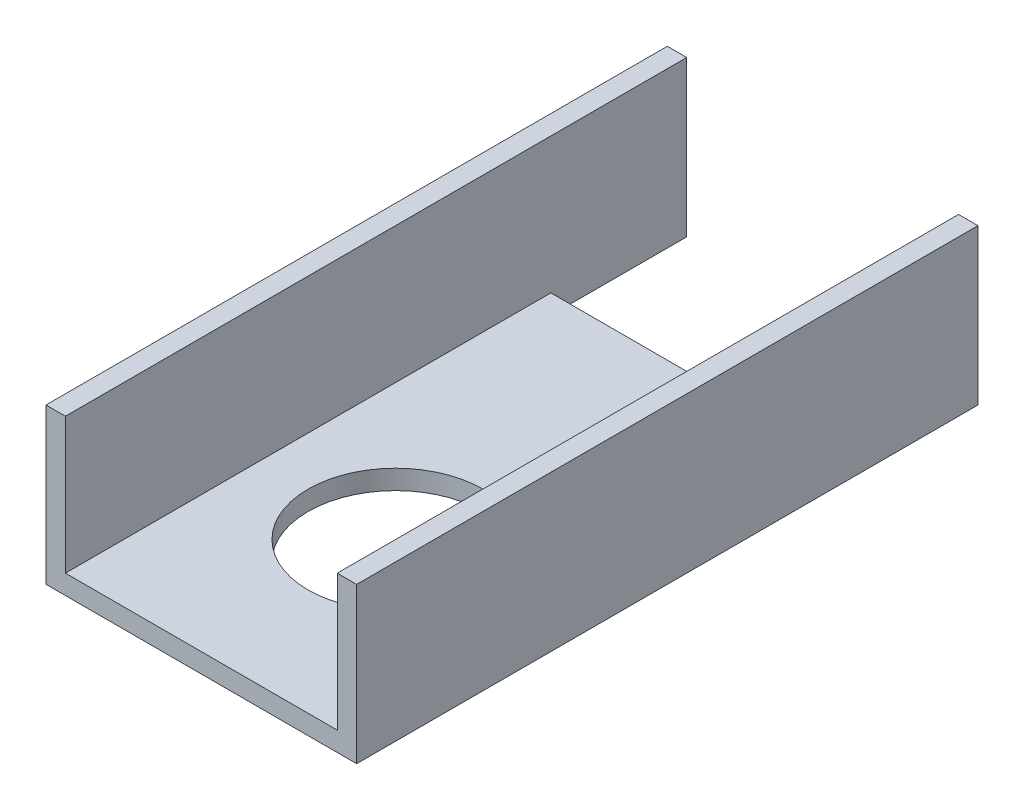
from build123d import *

# Parameters (mm, degrees)
BOSS_EXTRUDE1_DEPTH = 101.6
CUT_EXTRUDE1_REACH  = 118.397
SKETCH2_R           = 14.2875
CUT_EXTRUDE2_REACH  = 117.746
SKETCH3_W           = 44.45
SKETCH3_H           = 22.225


with BuildPart() as part:
    # Sketch1 → Boss-Extrude1 (new body)
    with BuildSketch(Plane.XY):
        Polygon((47.625, 3.175), (47.625, 25.4), (50.8, 25.4), (50.8, 0), (0, 0), (0, 25.4), (3.175, 25.4), (3.175, 3.175), align=None)
    extrude(amount=BOSS_EXTRUDE1_DEPTH)

    # Sketch2 → Cut-Extrude1 (cut, up to next)
    with BuildSketch(Plane.XZ, mode=Mode.PRIVATE) as cut_extrude1_sk1:
        with Locations((25.4, 69.85)):
            Circle(SKETCH2_R)
    cut_extrude1_tool1 = extrude(cut_extrude1_sk1.sketch, amount=-CUT_EXTRUDE1_REACH, mode=Mode.PRIVATE) & part.part
    add(cut_extrude1_tool1.solids().sort_by_distance((25.4, 0, 69.85))[0], mode=Mode.SUBTRACT)

    # Sketch3 → Cut-Extrude2 (cut, up to next)
    with BuildSketch(Plane(origin=(0, 3.175, 0), x_dir=(1, 0, 0), z_dir=(0, 1, 0)), mode=Mode.PRIVATE) as cut_extrude2_sk1:
        with Locations((25.4, -11.1125)):
            Rectangle(SKETCH3_W, SKETCH3_H)
    cut_extrude2_tool1 = extrude(cut_extrude2_sk1.sketch, amount=-CUT_EXTRUDE2_REACH, mode=Mode.PRIVATE) & part.part
    add(cut_extrude2_tool1.solids().sort_by_distance((25.4, 3.175, 11.1125))[0], mode=Mode.SUBTRACT)


solid = part.part
